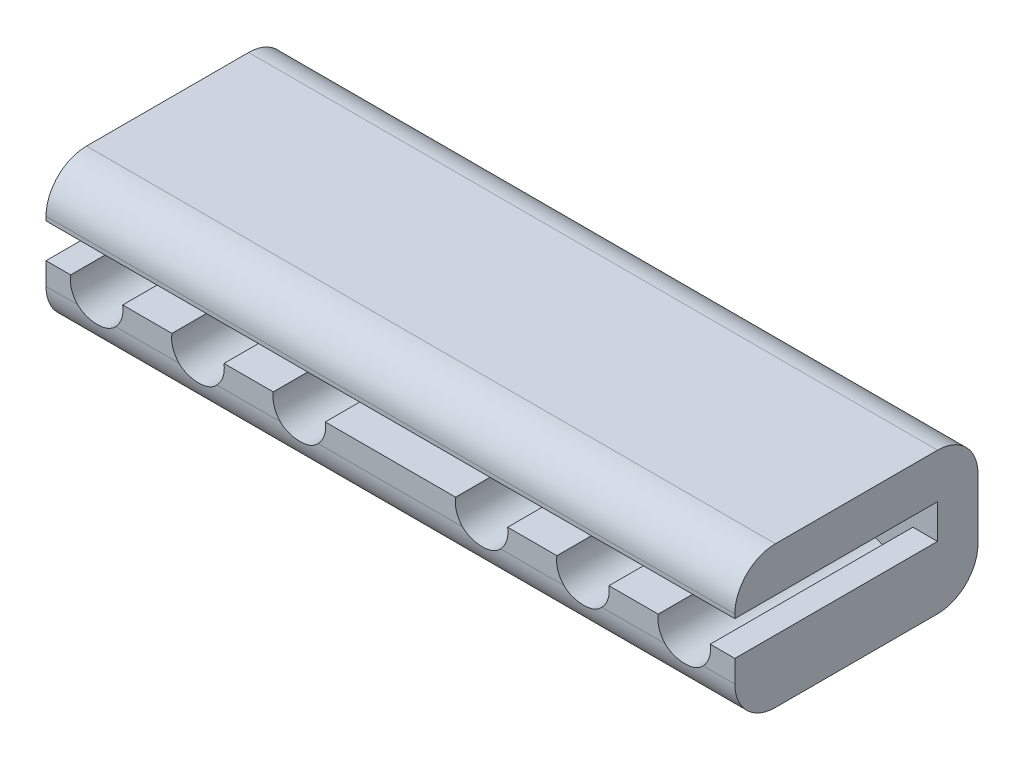
from build123d import *

# Parameters (mm, degrees)
SKETCH2_W             = 17
SKETCH2_H             = 2.2
BOSS_EXTRUDE1_DEPTH   = 10
BOSS_EXTRUDE1_2_DEPTH = 10
SKETCH2_4_W           = 17
SKETCH2_4_H           = 7
BOSS_EXTRUDE2_DEPTH   = 2
FILLET2_R             = 2


with BuildPart() as part:
    # Sketch2 → Boss-Extrude1 (new body)
    with BuildSketch(Plane.XY):
        with Locations((8.5, 2.4)):
            Rectangle(SKETCH2_W, SKETCH2_H)
    extrude(amount=BOSS_EXTRUDE1_DEPTH)



with BuildPart() as body_2:
    # Sketch2 → Boss-Extrude1 2 (new body)
    with BuildSketch(Plane.XY):
        with BuildLine():
            Line((1.215476742, -0.4), (0, -0.4))
            Line((0, -0.4), (0, -3.5))
            Line((0, -3.5), (17, -3.5))
            Line((17, -3.5), (17, -0.4))
            Line((17, -0.4), (13.784523258, -0.4))
            ThreePointArc((13.784523258, -0.4), (12.5, -1.9), (11.215476742, -0.4))
            Line((11.215476742, -0.4), (8.784523258, -0.4))
            ThreePointArc((8.784523258, -0.4), (7.5, -1.9), (6.215476742, -0.4))
            Line((6.215476742, -0.4), (3.784523258, -0.4))
            ThreePointArc((3.784523258, -0.4), (2.5, -1.9), (1.215476742, -0.4))
        make_face()
    extrude(amount=BOSS_EXTRUDE1_2_DEPTH)


with BuildPart() as part_1:
    add(part.part)

    add(body_2.part)  # Boss-Extrude2 merges body 2
    # Sketch2<4> → Boss-Extrude2 (add)
    with BuildSketch(Plane.XY):
        with Locations((8.5, 0)):
            Rectangle(SKETCH2_4_W, SKETCH2_4_H)
    extrude(amount=-BOSS_EXTRUDE2_DEPTH)

    # Mirror1: part across plane


with BuildPart() as part_2:
    add(part_1.part)
    add(part_1.part.mirror(Plane(origin=(17, 0, 10), x_dir=(0, 0, 1), z_dir=(-1, 0, 0))))

    # Fillet2
    # the kernel refuses this fillet: 2 mm, written as the material it takes off along each edge
    with BuildSketch(Plane(origin=(-5, -3.5, 10), x_dir=(0, 0, -1), z_dir=(1, 0, 0)), Plane(origin=(-5, 3.5, -2), x_dir=(0, 0, 1), z_dir=(1, 0, 0)), Plane(origin=(-5, -3.5, -2), x_dir=(0, 1, 0), z_dir=(1, 0, 0))) as fillet2_piece_1:
        with BuildLine():
            CenterArc((FILLET2_R, FILLET2_R), FILLET2_R, 180, 90)
            Line((0, FILLET2_R), (0, 0))
            Line((0, 0), (FILLET2_R, 0))
        make_face()
    extrude(amount=44, mode=Mode.SUBTRACT)
    with BuildSketch(Plane(origin=(39, 3.5, 10), x_dir=(0, -1, 0), z_dir=(-1, 0, 0))) as fillet2_piece_2:
        with BuildLine():
            CenterArc((FILLET2_R, -FILLET2_R), FILLET2_R, 90, 90)
            Line((0, -FILLET2_R), (0, 0))
            Line((0, 0), (FILLET2_R, 0))
        make_face()
    extrude(amount=44, mode=Mode.SUBTRACT)


solid = part_2.part
